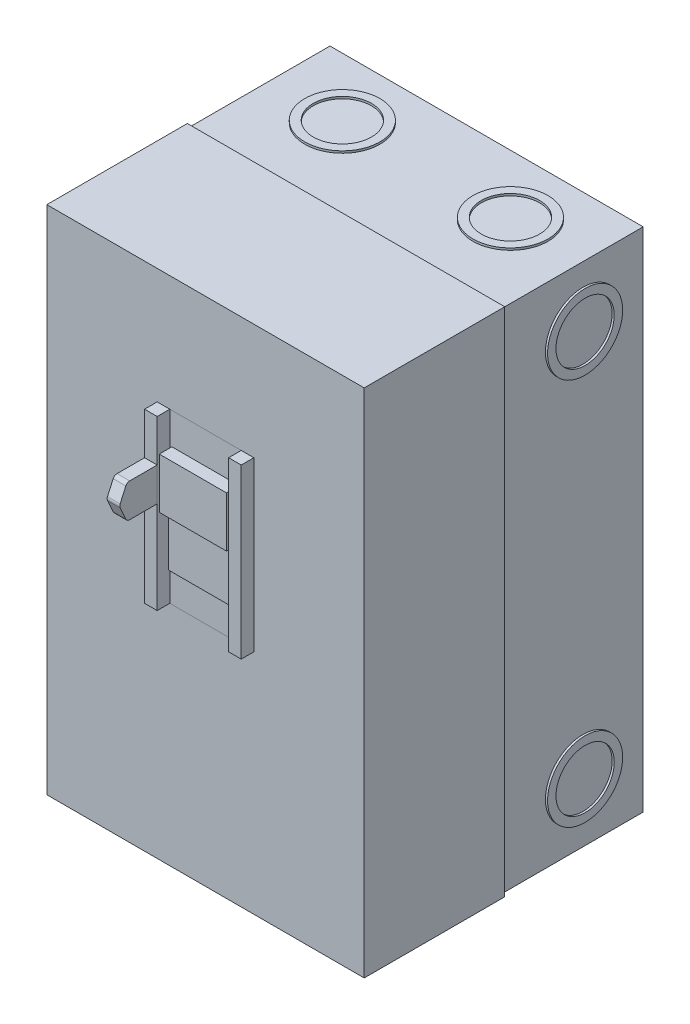
from build123d import *

# Parameters (mm, degrees)
SKETCH4_W              = 118.3005
SKETCH4_H              = 191.4525
BOSS_EXTRUDE1_DEPTH    = 53.086
SKETCH5_W              = 119.888
SKETCH5_H              = 193.04
BOSS_EXTRUDE2_DEPTH    = 53.086
SKETCH6_R              = 12.7
SKETCH6_R_2            = 9.525
BOSS_EXTRUDE3_DEPTH    = 3.175
FILLET1_R              = 3.175
SKETCH7_R              = 2.794
CUT_EXTRUDE1_DEPTH     = 6.35
CUT_EXTRUDE2_DEPTH     = 6.35
SKETCH9_R              = 14.1859
SKETCH9_R_2            = 11.0109
BOSS_EXTRUDE4_DEPTH    = 0.79375
SKETCH10_R             = 14.1859
SKETCH10_R_2           = 11.0109
BOSS_EXTRUDE5_DEPTH    = 0.79375
SKETCH11_W             = 36.5125
SKETCH11_H             = 63.5
CUT_EXTRUDE3_DEPTH     = 1.27
BOSS_EXTRUDE6_DEPTH    = 63.5
SKETCH13_W             = 25.4
SKETCH13_H             = 19.05
CUT_EXTRUDE4_DEPTH     = 1.27
SKETCH14_W             = 25.4
SKETCH14_H             = 19.05
BOSS_EXTRUDE7_DEPTH    = 6.0325
SKETCH15_W             = 25.4
SKETCH15_H             = 19.05
BOSS_EXTRUDE8_DEPTH    = 2.54
BOSS_EXTRUDE9_DEPTH    = 4.7625
BOSS_EXTRUDE10_DEPTH   = 19.05
BOSS_EXTRUDE10_2_DEPTH = 19.05
FILLET2_R              = 3.175
SKETCH18_W             = 22.225
SKETCH18_H             = 11.1125
CUT_EXTRUDE5_DEPTH     = 38.1
SKETCH19_W             = 22.225
SKETCH19_H             = 15.875
CUT_EXTRUDE6_DEPTH     = 3.175
FILLET3_R              = 3.175
SKETCH20_R             = 5.08
CUT_EXTRUDE7_DEPTH     = 146.232229644
SKETCH21_R             = 2.159
CUT_EXTRUDE8_DEPTH     = 147.702207216
BOSS_EXTRUDE11_DEPTH   = 3.175
SKETCH23_W             = 0.635
SKETCH23_H             = 1.27
CUT_EXTRUDE9_DEPTH     = 7.9375
SKETCH24_R             = 2.032
BOSS_EXTRUDE12_DEPTH   = 19.05


with BuildPart() as part:
    # Sketch4 → Boss-Extrude1 (new body)
    with BuildSketch(Plane.XY):
        Rectangle(SKETCH4_W, SKETCH4_H)
    extrude(amount=BOSS_EXTRUDE1_DEPTH)

    # Sketch5 → Boss-Extrude2 (add)
    with BuildSketch(Plane.XY.offset(53.086)):
        Rectangle(SKETCH5_W, SKETCH5_H)
    extrude(amount=BOSS_EXTRUDE2_DEPTH)

    # Sketch6 → Boss-Extrude3 (add)
    with BuildSketch(Plane(origin=(0, 0, 0), x_dir=(-1, 0, 0), z_dir=(0, 0, -1))):
        with Locations((41.275, 73.025)):
            Circle(SKETCH6_R)
        with Locations((-41.275, 73.025)):
            Circle(SKETCH6_R)
        with Locations((41.275, -76.2)):
            Circle(SKETCH6_R_2)
        with Locations((-41.275, -76.2)):
            Circle(SKETCH6_R_2)
    extrude(amount=BOSS_EXTRUDE3_DEPTH)

    # Fillet1
    fillet1_edges = [part.edges().sort_by_distance(p)[0] for p in [
        (-28.575, 73.025, -3.175),
        (53.975, 73.025, -3.175),
        (-31.75, -76.2, -3.175),
        (50.8, -76.2, -3.175),
    ]]
    fillet(fillet1_edges, radius=FILLET1_R - 0.0001)  # a hair under: the kernel refuses the full size

    # Sketch7 → Cut-Extrude1 (cut)
    with BuildSketch(Plane(origin=(0, 0, -3.175), x_dir=(-1, 0, 0), z_dir=(0, 0, -1))):
        with Locations((-41.275, 76.2)):
            Circle(SKETCH7_R)
        with Locations((41.275, 76.2)):
            Circle(SKETCH7_R)
        with Locations((41.275, -76.2)):
            Circle(SKETCH7_R)
        with Locations((-41.275, -76.2)):
            Circle(SKETCH7_R)
    extrude(amount=-CUT_EXTRUDE1_DEPTH, mode=Mode.SUBTRACT)

    # Sketch8 → Cut-Extrude2 (cut)
    with BuildSketch(Plane(origin=(0, 0, -3.175), x_dir=(-1, 0, 0), z_dir=(0, 0, -1))):
        with BuildLine():
            Line((-46.399082346, 71.204666667), (-43.851681408, 77.280346667))
            ThreePointArc((-43.851681408, 77.280346667), (-41.275, 78.994), (-38.698318592, 77.280346667))
            Line((-38.698318592, 77.280346667), (-36.150917654, 71.204666667))
            ThreePointArc((-36.150917654, 71.204666667), (-41.275, 63.5), (-46.399082346, 71.204666667))
        make_face()
        with BuildLine():
            Line((38.698318592, 77.280346667), (36.150917654, 71.204666667))
            ThreePointArc((36.150917654, 71.204666667), (41.275, 63.5), (46.399082346, 71.204666667))
            Line((46.399082346, 71.204666667), (43.851681408, 77.280346667))
            ThreePointArc((43.851681408, 77.280346667), (41.275, 78.994), (38.698318592, 77.280346667))
        make_face()
    extrude(amount=-CUT_EXTRUDE2_DEPTH, mode=Mode.SUBTRACT)

    # Sketch9 → Boss-Extrude4 (add)
    # profile 1 of 2: a face of its own
    with BuildSketch(Plane(origin=(59.15025, 0, 0), x_dir=(0, 0, -1), z_dir=(1, 0, 0))):
        with Locations(Location((-22.733, 73.152, 0), (0, 0, 180))):
            Circle(SKETCH9_R)
        with Locations((-22.733, 73.152)):
            Circle(SKETCH9_R_2, mode=Mode.SUBTRACT)
    # profile 2 of 2: a face of its own
    with BuildSketch(Plane(origin=(59.15025, 0, 0), x_dir=(0, 0, -1), z_dir=(1, 0, 0))):
        with Locations(Location((-22.733, -73.152, 0), (0, 0, 180))):
            Circle(SKETCH9_R)
        with Locations((-22.733, -73.152)):
            Circle(SKETCH9_R_2, mode=Mode.SUBTRACT)
    boss_extrude4 = extrude(amount=BOSS_EXTRUDE4_DEPTH)

    # Mirror1: Boss-Extrude4 across plane
    add(boss_extrude4.mirror(Plane(origin=(0, 0, 0), x_dir=(0, 0, 1), z_dir=(1, 0, 0))))

    # Sketch10 → Boss-Extrude5 (add)
    # profile 1 of 2: a face of its own
    with BuildSketch(Plane(origin=(0, 95.72625, 0), x_dir=(1, 0, 0), z_dir=(0, 1, 0))):
        with Locations(Location((31.75, -22.733, 0), (0, 0, 90))):
            Circle(SKETCH10_R)
        with Locations(Location((31.75, -22.733, 0), (0, 0, 270))):
            Circle(SKETCH10_R_2, mode=Mode.SUBTRACT)
    # profile 2 of 2: a face of its own
    with BuildSketch(Plane(origin=(0, 95.72625, 0), x_dir=(1, 0, 0), z_dir=(0, 1, 0))):
        with Locations(Location((-31.75, -22.733, 0), (0, 0, 90))):
            Circle(SKETCH10_R)
        with Locations(Location((-31.75, -22.733, 0), (0, 0, 90))):
            Circle(SKETCH10_R_2, mode=Mode.SUBTRACT)
    boss_extrude5 = extrude(amount=BOSS_EXTRUDE5_DEPTH)

    # Mirror2: Boss-Extrude5 across plane
    add(boss_extrude5.mirror(Plane.ZX))

    # Sketch11 → Cut-Extrude3 (cut)
    with BuildSketch(Plane.XY.offset(106.172)):
        with Locations((0, 21.082)):
            Rectangle(SKETCH11_W, SKETCH11_H)
    extrude(amount=-CUT_EXTRUDE3_DEPTH, mode=Mode.SUBTRACT)


with BuildPart() as body_2:
    # Sketch12 → Boss-Extrude6 (new body)
    with BuildSketch(Plane.XZ.offset(-52.832)):
        Polygon((-18.25625, 104.902), (-18.25625, 110.9345), (-13.49375, 110.9345), (-13.49375, 106.172), (0, 106.172), (13.49375, 106.172), (13.49375, 110.9345), (18.25625, 110.9345), (18.25625, 104.902), (0, 104.902), align=None)
    extrude(amount=BOSS_EXTRUDE6_DEPTH)

    # Sketch13 → Cut-Extrude4 (cut)
    with BuildSketch(Plane.XY.offset(106.172)):
        with Locations((0, 31.40075)):
            Rectangle(SKETCH13_W, SKETCH13_H)
        with Locations((0, 10.76325)):
            Rectangle(SKETCH13_W, SKETCH13_H)
    extrude(amount=-CUT_EXTRUDE4_DEPTH, mode=Mode.SUBTRACT)


with BuildPart() as body_3:
    # Sketch14 → Boss-Extrude7 (new body)
    with BuildSketch(Plane.XY.offset(104.902)):
        with Locations((0, 31.40075)):
            Rectangle(SKETCH14_W, SKETCH14_H)
    extrude(amount=BOSS_EXTRUDE7_DEPTH)


with BuildPart() as body_4:
    # Sketch15 → Boss-Extrude8 (new body)
    with BuildSketch(Plane.XY.offset(104.902)):
        with Locations((0, 10.76325)):
            Rectangle(SKETCH15_W, SKETCH15_H)
    extrude(amount=BOSS_EXTRUDE8_DEPTH)


with BuildPart() as body_5:
    # Sketch16 → Boss-Extrude9 (new body)
    with BuildSketch(Plane.ZY.offset(18.25625)):
        with BuildLine():
            Line((124.928845734, 31.258453925), (122.785720734, 36.020953925))
            ThreePointArc((122.785720734, 36.020953925), (122.200012033, 36.702605276), (121.338045344, 36.957))
            Line((121.338045344, 36.957), (110.9345, 36.957))
            Line((110.9345, 36.957), (110.9345, 24.257))
            Line((110.9345, 24.257), (121.338045344, 24.257))
            ThreePointArc((121.338045344, 24.257), (122.200012033, 24.511394724), (122.785720734, 25.193046075))
            Line((122.785720734, 25.193046075), (124.928845734, 29.955546075))
            ThreePointArc((124.928845734, 29.955546075), (125.068670344, 30.607), (124.928845734, 31.258453925))
        make_face()
    extrude(amount=-BOSS_EXTRUDE9_DEPTH)


with BuildPart() as body_6:
    # Sketch17 → Boss-Extrude10 (new, symmetric)
    with BuildSketch(Plane(origin=(0, 0, 0), x_dir=(0, 0, -1), z_dir=(1, 0, 0))):
        Polygon((-36.576, -95.72625), (-52.451, -95.72625), (-52.451, -111.60125), (-50.8635, -111.60125), (-50.8635, -97.31375), (-36.576, -97.31375), align=None)
    extrude(amount=BOSS_EXTRUDE10_DEPTH, both=True)

    # Fillet2
    fillet2_edges = [body_6.edges().sort_by_distance(p)[0] for p in [
        (19.05, -111.60125, 51.65725),
        (19.05, -96.52, 36.576),
        (-19.05, -111.60125, 51.65725),
        (-19.05, -96.52, 36.576),
    ]]
    fillet(fillet2_edges, radius=FILLET2_R)


with BuildPart() as body_7:
    # Sketch17 → Boss-Extrude10 2 (new, symmetric)
    with BuildSketch(Plane(origin=(0, 0, 0), x_dir=(0, 0, -1), z_dir=(1, 0, 0))):
        Polygon((-69.596, -96.52), (-69.596, -112.395), (-68.0085, -112.395), (-68.0085, -98.1075), (-55.3085, -98.1075), (-55.3085, -112.395), (-53.721, -112.395), (-53.721, -96.52), align=None)
    extrude(amount=BOSS_EXTRUDE10_2_DEPTH, both=True)

    # Sketch18 → Cut-Extrude5 (cut)
    with BuildSketch(Plane.XY.offset(55.3085)):
        with Locations((7.9375, -106.83875)):
            Rectangle(SKETCH18_W, SKETCH18_H)
    extrude(amount=-CUT_EXTRUDE5_DEPTH, mode=Mode.SUBTRACT)

    # Sketch19 → Cut-Extrude6 (cut)
    with BuildSketch(Plane.XY.offset(69.596)):
        with Locations((-7.9375, -104.4575)):
            Rectangle(SKETCH19_W, SKETCH19_H)
    extrude(amount=-CUT_EXTRUDE6_DEPTH, mode=Mode.SUBTRACT)

    # Fillet3
    fillet3_edges = [body_7.edges().sort_by_distance(p)[0] for p in [
        (19.05, -112.395, 68.80225),
        (-3.175, -112.395, 54.51475),
        (-3.175, -101.2825, 54.51475),
        (-19.05, -97.31375, 66.421),
        (3.175, -112.395, 68.80225),
        (-19.05, -112.395, 54.51475),
    ]]
    fillet(fillet3_edges, radius=FILLET3_R)


with BuildPart() as cut_extrude7_tool:
    # Sketch20 → Cut-Extrude7 (new, through all)
    with BuildSketch(Plane.XY.offset(55.3085)):
        with Locations((-11.1125, -105.25125)):
            Circle(SKETCH20_R)
    extrude(amount=-CUT_EXTRUDE7_DEPTH)


with BuildPart() as body_6_1:
    add(body_6.part)

    # Cut-Extrude7: cut by cut_extrude7_tool
    add(cut_extrude7_tool.part, mode=Mode.SUBTRACT)


with BuildPart() as body_7_1:
    add(body_7.part)

    # Cut-Extrude7: cut by cut_extrude7_tool
    add(cut_extrude7_tool.part, mode=Mode.SUBTRACT)


with BuildPart() as cut_extrude8_tool:
    # Sketch21 → Cut-Extrude8 (new, through all)
    with BuildSketch(Plane.XY.offset(69.596)):
        with Locations((11.1125, -104.4575)):
            Circle(SKETCH21_R)
    extrude(amount=-CUT_EXTRUDE8_DEPTH)


with BuildPart() as body_6_2:
    add(body_6_1.part)

    # Cut-Extrude8: cut by cut_extrude8_tool
    add(cut_extrude8_tool.part, mode=Mode.SUBTRACT)


with BuildPart() as body_7_2:
    add(body_7_1.part)

    # Cut-Extrude8: cut by cut_extrude8_tool
    add(cut_extrude8_tool.part, mode=Mode.SUBTRACT)



with BuildPart() as body_8:
    # Sketch22 → Boss-Extrude11 (new body)
    with BuildSketch(Plane.XY.offset(69.596)):
        Polygon((6.529782238, -104.4575), (8.821141119, -108.42625), (13.403858881, -108.42625), (15.695217762, -104.4575), (13.403858881, -100.48875), (8.821141119, -100.48875), align=None)
    extrude(amount=BOSS_EXTRUDE11_DEPTH)

    # Sketch23 → Cut-Extrude9 (cut)
    with BuildSketch(Plane.XZ.offset(108.42625)):
        with Locations((11.1125, 72.136)):
            Rectangle(SKETCH23_W, SKETCH23_H)
    extrude(amount=-CUT_EXTRUDE9_DEPTH, mode=Mode.SUBTRACT)


with BuildPart() as body_7_3:
    add(body_7_2.part)

    add(body_8.part)  # Boss-Extrude12 merges body 8
    # Sketch24 → Boss-Extrude12 (add)
    with BuildSketch(Plane(origin=(0, 0, 69.596), x_dir=(-1, 0, 0), z_dir=(0, 0, -1))):
        with Locations(Location((-11.1125, -104.4575, 0), (0, 0, 180))):
            Circle(SKETCH24_R)
    extrude(amount=BOSS_EXTRUDE12_DEPTH)


solid = Compound([part.part, body_2.part, body_3.part, body_4.part, body_5.part, body_6_2.part, body_7_3.part])
